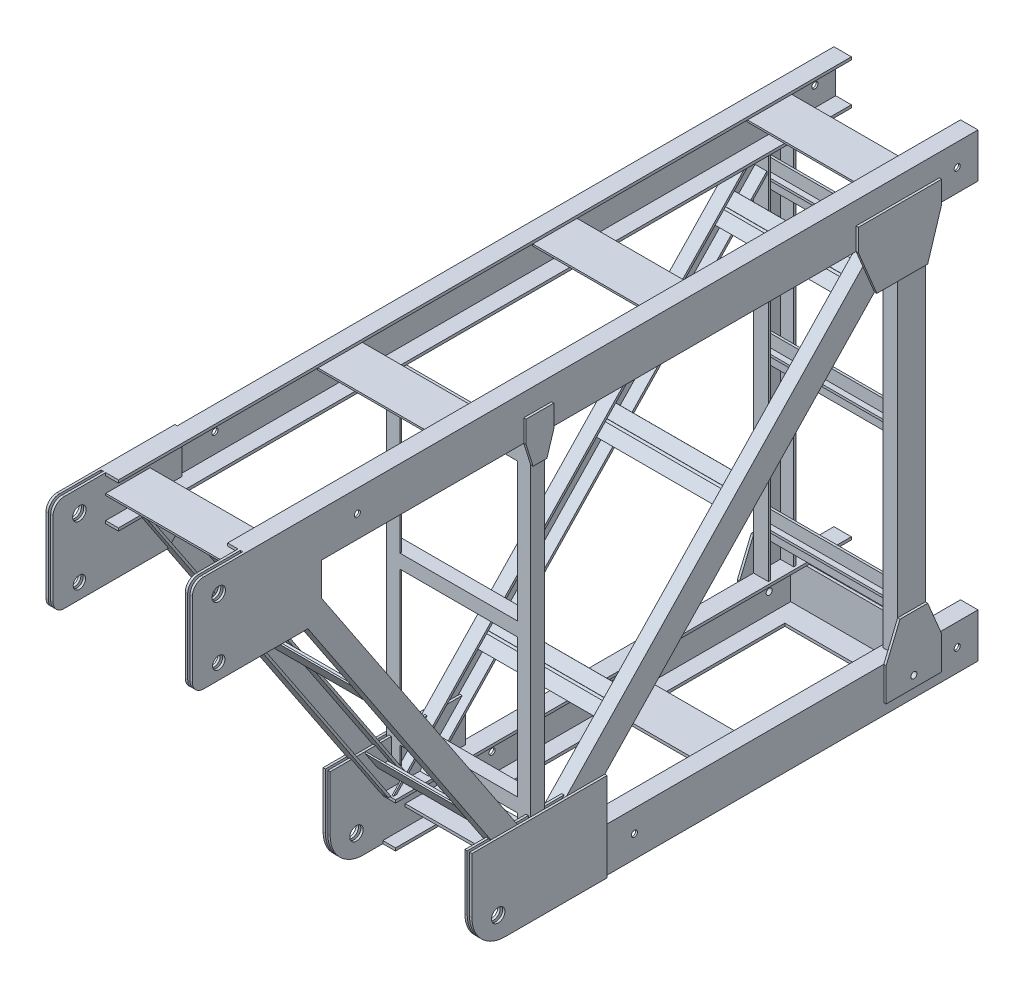
from build123d import *

# Parameters (mm, degrees)
EXTRUDE_1_DEPTH                   = 2835
EXTRUDE_1_2_DEPTH                 = 2835
PATTERN_LINEAR_2_COUNT            = 2
PATTERN_LINEAR_2_PITCH            = 1500
SKETCH_4_W                        = 520
SKETCH_4_H                        = 1000
CUT_EXTRUDE_2_DEPTH               = 1000
EXTRUDE_3_DEPTH                   = 520
SKETCH_8_W                        = 100
SKETCH_8_H                        = 1340
EXTRUDE_7_DEPTH                   = 520
CUT_EXTRUDE_9_DEPTH               = 1340
SKETCH_11_R                       = 11
CUT_EXTRUDE_10_DEPTH              = 3250.249913442
EXTRUDE_11_DEPTH                  = 48
PATTERN_LINEAR_3_COUNT            = 2
PATTERN_LINEAR_3_PITCH            = 472
CUT_EXTRUDE_12_DEPTH              = 42.7
CUT_EXTRUDE_13_DEPTH              = 42.7
EXTRUDE_14_DEPTH                  = 43
PATTERN_LINEAR_4_COUNT            = 2
PATTERN_LINEAR_4_PITCH            = 477
CUT_EXTRUDE_15_DEPTH              = 38
CUT_EXTRUDE_16_DEPTH              = 38
EXTRUDE_17_DEPTH                  = 520
SKETCH_19_W                       = 394
SKETCH_19_H                       = 50
CUT_EXTRUDE_18_DEPTH              = 3250.249913442
CUT_EXTRUDE_19_DEPTH              = 15
CUT_EXTRUDE_20_DEPTH              = 15
CUT_EXTRUDE_21_DEPTH              = 45
CUT_EXTRUDE_22_DEPTH              = 45
PATTERN_LINEAR_6_COUNT            = 4
PATTERN_LINEAR_6_PITCH            = 775
SKETCH_27_W                       = 520
SKETCH_27_H                       = 160
EXTRUDE_24_DEPTH                  = 10
SKETCH_28_W                       = 507
SKETCH_28_H                       = 10
EXTRUDE_25_DEPTH                  = 140
EXTRUDE_26_DEPTH                  = 520
PATTERN_LINEAR_9_COUNT            = 3
PATTERN_LINEAR_9_PITCH            = 550
EXTRUDE_27_DEPTH                  = 520
PATTERN_LINEAR_10_COUNT           = 3
PATTERN_LINEAR_10_PITCH           = 620
EXTRUDE_28_DEPTH                  = 520
SKETCH_32_W                       = 400
SKETCH_32_H                       = 5
EXTRUDE_29_DEPTH                  = 15
PATTERN_LINEAR_11_COUNT           = 3
PATTERN_LINEAR_11_PITCH           = 675
SKETCH_38_W                       = 520
SKETCH_38_H                       = 50
EXTRUDE_36_DEPTH                  = 50
SKETCH_38_2_W                     = 520
SKETCH_38_2_H                     = 50
EXTRUDE_37_DEPTH                  = 50
PATTERN_LINEAR_13_COUNT           = 3
PATTERN_LINEAR_13_PITCH           = 550
SKETCH_39_W                       = 514
SKETCH_39_H                       = 45
CUT_EXTRUDE_38_DEPTH              = 45
SKETCH_40_W                       = 488.125335809
SKETCH_40_H                       = 320
EXTRUDE_39_DEPTH                  = 8.5
PATTERN_LINEAR_15_COUNT           = 2
PATTERN_LINEAR_15_PITCH           = 17
PATTERN_LINEAR_16_COUNT           = 2
PATTERN_LINEAR_16_PITCH           = 511.5
PATTERN_LINEAR_16_COPY_1_SKETCH_W = 488.125335809
PATTERN_LINEAR_16_COPY_1_SKETCH_H = 320
PATTERN_LINEAR_16_COPY_1_DEPTH    = 8.5
SKETCH_41_W                       = 8.5
SKETCH_41_H                       = 160
SKETCH_41_W_2                     = 486
CUT_EXTRUDE_40_DEPTH              = 190
SKETCH_42_W                       = 160
SKETCH_42_H                       = 10
EXTRUDE_41_DEPTH                  = 503
FILLET_1_R                        = 120
SKETCH_43_R                       = 24.25
CUT_EXTRUDE_42_DEPTH              = 3253.013837609
SKETCH_44_W                       = 465
SKETCH_44_H                       = 350
EXTRUDE_43_DEPTH                  = 8.5
PATTERN_LINEAR_17_COUNT           = 2
PATTERN_LINEAR_17_PITCH           = 17
SKETCH_45_W                       = 8.5
SKETCH_45_H                       = 350
SKETCH_45_W_2                     = 496.5
CUT_EXTRUDE_44_DEPTH              = 190
CHAMFER_1_SIZE                    = 50
SKETCH_46_R                       = 24.25
CUT_EXTRUDE_45_DEPTH              = 3253.013837609
EXTRUDE_46_DEPTH                  = 8.5
PATTERN_LINEAR_19_COUNT           = 2
PATTERN_LINEAR_19_PITCH           = 528.5
PATTERN_LINEAR_20_COUNT           = 2
PATTERN_LINEAR_20_PITCH           = 662
PATTERN_LINEAR_21_COUNT           = 2
PATTERN_LINEAR_21_PITCH           = 520
PATTERN_LINEAR_22_COUNT           = 2
PATTERN_LINEAR_22_PITCH           = 503
SKETCH_49_R                       = 24.25
SKETCH_49_R_2                     = 22.25
CUT_EXTRUDE_48_DEPTH              = 3251.621056045
FILLET_2_R                        = 40
SKETCH_51_R                       = 11
CUT_EXTRUDE_50_DEPTH              = 3253.013837609


with BuildPart() as part:
    # 草图2 → 拉伸1 (new body)
    with BuildSketch(Plane.XY):
        Polygon((0, 0), (0, 160), (63, 160), (63, 150), (6.5, 150), (6.5, 10), (63, 10), (63, 0), align=None)
    extrude_1 = extrude(amount=EXTRUDE_1_DEPTH)



with BuildPart() as body_2:
    # 草图2 → Extrude 1 2 (new body)
    with BuildSketch(Plane.XY):
        Polygon((457, 160), (520, 160), (520, 0), (457, 0), (457, 10), (513.5, 10), (513.5, 150), (457, 150), align=None)
    extrude_1_2 = extrude(amount=EXTRUDE_1_2_DEPTH)


with BuildPart() as pattern_linear_2_1:
    # 阵列(线性)2: pattern copy
    add(extrude_1.moved(Location(Vector(0, -1, 0) * (1 * PATTERN_LINEAR_2_PITCH))))


with BuildPart() as pattern_linear_2_2:
    # 阵列(线性)2: pattern copy
    add(extrude_1_2.moved(Location(Vector(0, -1, 0) * (1 * PATTERN_LINEAR_2_PITCH))))


with BuildPart() as cut_extrude_2_tool:
    # 草图4 → 拉伸2 (new body)
    with BuildSketch(Plane(origin=(0, -1340, 0), x_dir=(1, 0, 0), z_dir=(0, 1, 0))):
        with Locations((260, -2335)):
            Rectangle(SKETCH_4_W, SKETCH_4_H)
    extrude(amount=-CUT_EXTRUDE_2_DEPTH)


with BuildPart() as pattern_linear_2_1_1:
    add(pattern_linear_2_1.part)

    # 拉伸2: cut by cut_extrude_2_tool
    add(cut_extrude_2_tool.part, mode=Mode.SUBTRACT)


with BuildPart() as pattern_linear_2_2_1:
    add(pattern_linear_2_2.part)

    # 拉伸2: cut by cut_extrude_2_tool
    add(cut_extrude_2_tool.part, mode=Mode.SUBTRACT)


with BuildPart() as part_1:
    add(part.part)

    add(body_2.part)  # 拉伸3 merges body 2
    # 草图5 → 拉伸3 (add)
    with BuildSketch(Plane.ZY):
        Polygon((160, 95), (320, 95), (320, 88.5), (243.25, 88.5), (243.25, 48.5), (236.75, 48.5), (236.75, 88.5), (160, 88.5), align=None)
    extrude_3 = extrude(amount=-EXTRUDE_3_DEPTH)

    # 草图11 → 拉伸10 (cut, through all)
    with BuildSketch(Plane.ZY):
        with Locations((2740, 80)):
            Circle(SKETCH_11_R)
    extrude(amount=-CUT_EXTRUDE_10_DEPTH, mode=Mode.SUBTRACT)


    add(pattern_linear_2_1_1.part)  # 拉伸11 merges 阵列(线性)2_1


with BuildPart() as body_4:
    # 草图8 → 拉伸7 (new body)
    with BuildSketch(Plane.ZY):
        with Locations((240, -670)):
            Rectangle(SKETCH_8_W, SKETCH_8_H)
    extrude(amount=-EXTRUDE_7_DEPTH)

    # 草图10 → 拉伸9 (cut)
    with BuildSketch(Plane.XZ.offset(1340)):
        Polygon((466.7, 290), (466.7, 281.5), (514.7, 281.5), (514.7, 198.5), (466.7, 198.5), (466.7, 190), (53.3, 190), (53.3, 198.5), (5.3, 198.5), (5.3, 281.5), (53.3, 281.5), (53.3, 290), align=None)
    extrude(amount=-CUT_EXTRUDE_9_DEPTH, mode=Mode.SUBTRACT)


with BuildPart() as cut_extrude_9_piece_1:
    # of the separate pieces the step leaves, piece 1, a body of its own (cut_extrude_9_pieces)
    add(body_4.part.solids().sort_by_distance((0, 0, 190))[0])


with BuildPart() as cut_extrude_9_piece_2:
    # of the separate pieces the step leaves, piece 2, a body of its own (cut_extrude_9_pieces)
    add(body_4.part.solids().sort_by_distance((466.7, 0, 198.5))[0])


with BuildPart() as part_2:
    add(part_1.part)

    add(cut_extrude_9_piece_1.part)  # 拉伸11 merges 拉伸9 piece 1
    # 草图12 → 拉伸11 (add)
    with BuildSketch(Plane.ZY):
        Polygon((290, 0), (359.111251302, 0), (1637.773223133, -1340), (1499.550720529, -1340), (290, -72.42655118), align=None)
    extrude_11 = extrude(amount=-EXTRUDE_11_DEPTH)


    add(pattern_linear_2_2_1.part)  # 阵列(线性)3 merges 阵列(线性)2_2

    add(cut_extrude_9_piece_2.part)  # 阵列(线性)3 merges 拉伸9 piece 2
    # 阵列(线性)3: 拉伸11 ×2
    with Locations(*[(i * PATTERN_LINEAR_3_PITCH, 0, 0) for i in range(1, PATTERN_LINEAR_3_COUNT)]):
        add(extrude_11)

    # 草图13 → 拉伸12 (cut)
    with BuildSketch(Plane(origin=(48, 0, 0), x_dir=(0, 0, -1), z_dir=(1, 0, 0))):
        Polygon((-347.362338581, 0), (-290, 0), (-290, -60.114037479), (-1511.29963325, -1340), (-1626.024310412, -1340), align=None)
    extrude(amount=-CUT_EXTRUDE_12_DEPTH, mode=Mode.SUBTRACT)

    # 草图14 → 拉伸13 (cut)
    with BuildSketch(Plane.ZY.offset(-472)):
        Polygon((290, -84.739064881), (290, 0), (347.362338581, 0), (1626.024310412, -1340), (1487.801807808, -1340), align=None)
    extrude(amount=-CUT_EXTRUDE_13_DEPTH, mode=Mode.SUBTRACT)

    # 草图15 → 拉伸14 (add)
    with BuildSketch(Plane.ZY):
        Polygon((2496.666666667, 0), (2448.59264966, 0), (1589.196969525, -1289.093520204), (1637.773223133, -1340), (1651.40735034, -1340), (2544.740683673, 0), align=None)
    extrude_14 = extrude(amount=-EXTRUDE_14_DEPTH)

    # 阵列(线性)4: 拉伸14 ×2
    with Locations(*[(i * PATTERN_LINEAR_4_PITCH, 0, 0) for i in range(1, PATTERN_LINEAR_4_COUNT)]):
        add(extrude_14)

    # 草图16 → 拉伸15 (cut)
    with BuildSketch(Plane.ZY.offset(-477)):
        Polygon((2458.207453062, 0), (2535.125880272, 0), (1641.792546938, -1340), (1564.874119728, -1340), align=None)
    extrude(amount=-CUT_EXTRUDE_15_DEPTH, mode=Mode.SUBTRACT)

    # 草图17 → 拉伸16 (cut)
    with BuildSketch(Plane(origin=(43, 0, 0), x_dir=(0, 0, -1), z_dir=(1, 0, 0))):
        Polygon((-2535.125880272, 0), (-2458.207453062, 0), (-1564.874119728, -1340), (-1641.792546938, -1340), align=None)
    extrude(amount=-CUT_EXTRUDE_16_DEPTH, mode=Mode.SUBTRACT)

    # 阵列(线性)6: 拉伸3 ×4
    with Locations(*[(0, 0, i * PATTERN_LINEAR_6_PITCH) for i in range(1, PATTERN_LINEAR_6_COUNT)]):
        add(extrude_3)

    # 草图27 → 拉伸24 (add)
    with BuildSketch(Plane.XZ.offset(1500)):
        with Locations((260, 160)):
            Rectangle(SKETCH_27_W, SKETCH_27_H)
    extrude(amount=-EXTRUDE_24_DEPTH)

    # 草图28 → 拉伸25 (add)
    with BuildSketch(Plane(origin=(0, -1490, 0), x_dir=(1, 0, 0), z_dir=(0, 1, 0))):
        with Locations((260, -157.5)):
            Rectangle(SKETCH_28_W, SKETCH_28_H)
    extrude(amount=EXTRUDE_25_DEPTH)

    # 草图29 → 拉伸26 (add)
    with BuildSketch(Plane.ZY):
        Polygon((231.5, -1160), (231.5, -1260), (240, -1260), (240, -1214.25), (260, -1214.25), (260, -1205.75), (240, -1205.75), (240, -1160), align=None)
    extrude_26 = extrude(amount=-EXTRUDE_26_DEPTH)

    # 阵列(线性)9: 拉伸26 ×3
    with Locations(*[(0, i * PATTERN_LINEAR_9_PITCH, 0) for i in range(1, PATTERN_LINEAR_9_COUNT)]):
        add(extrude_26)

    # 草图30 → 拉伸27 (add)
    with BuildSketch(Plane.ZY):
        Polygon((372.01655097, -98.263437964), (441.052007146, -170.61055809), (447.201512357, -164.742544315), (415.617791156, -131.643736857), (430.087215181, -117.836645622), (424.219201406, -111.687140411), (409.749777381, -125.494231647), (378.16605618, -92.395424189), align=None)
    extrude_27 = extrude(amount=-EXTRUDE_27_DEPTH)

    # 阵列(线性)10: 拉伸27 ×3
    with Locations(*[Vector(0, -0.723471201258805, 0.690354561764563) * (i * PATTERN_LINEAR_10_PITCH) for i in range(1, PATTERN_LINEAR_10_COUNT)]):
        add(extrude_27)

    # 草图31 → 拉伸28 (add)
    with BuildSketch(Plane(origin=(520, 0, 0), x_dir=(0, 0, -1), z_dir=(1, 0, 0))):
        Polygon((-2453.908526541, -59.630271094), (-2409.532510843, -126.194294641), (-2413.692762315, -128.967795622), (-2458.068778013, -62.403772075), align=None)
    extrude_28 = extrude(amount=-EXTRUDE_28_DEPTH)

    # 草图32 → 拉伸29 (add)
    with BuildSketch(Plane(origin=(0, -1150.920941817, 1726.381412726), x_dir=(-1, 0, 0), z_dir=(0, 0.5547001962252278, -0.8320502943378446))):
        with Locations((-260, 1271.568156576)):
            Rectangle(SKETCH_32_W, SKETCH_32_H)
    extrude_29 = extrude(amount=EXTRUDE_29_DEPTH)

    # 阵列(线性)11: 拉伸28, 拉伸29 ×3
    with Locations(*[Vector(0, -0.8320502943378436, -0.5547001962252294) * (i * PATTERN_LINEAR_11_PITCH) for i in range(1, PATTERN_LINEAR_11_COUNT)]):
        add(extrude_28)
        add(extrude_29)


with BuildPart() as body_2_2:
    # 草图18 → 拉伸17 (new body)
    with BuildSketch(Plane.ZY):
        Polygon((1564.196969525, 0), (1614.196969525, 0), (1614.196969525, -1251.593520204), (1589.196969525, -1289.093520204), (1564.196969525, -1262.894258211), align=None)
    extrude(amount=-EXTRUDE_17_DEPTH)

    # 草图19 → 拉伸18 (cut, through all)
    with BuildSketch(Plane(origin=(0, 0, 0), x_dir=(1, 0, 0), z_dir=(0, 1, 0))):
        with Locations((260, -1589.196969525)):
            Rectangle(SKETCH_19_W, SKETCH_19_H)
    extrude(amount=-CUT_EXTRUDE_18_DEPTH, mode=Mode.SUBTRACT)


with BuildPart() as cut_extrude_18_piece_1:
    # of the separate pieces the step leaves, piece 1, a body of its own (cut_extrude_18_pieces)
    add(body_2_2.part.solids().sort_by_distance((0, 0, 1564.196969525))[0])

    # 草图21 → 拉伸20 (cut)
    with BuildSketch(Plane(origin=(63, 0, 0), x_dir=(0, 0, -1), z_dir=(1, 0, 0))):
        Polygon((-1614.196969525, -1251.593520204), (-1589.196969525, -1289.093520204), (-1564.196969525, -1262.894258211), (-1564.196969525, 0), (-1614.196969525, 0), align=None)
    extrude(amount=-CUT_EXTRUDE_20_DEPTH, mode=Mode.SUBTRACT)

    # 草图24 → 拉伸22 (cut)
    with BuildSketch(Plane(origin=(48, 0, 0), x_dir=(0, 0, -1), z_dir=(1, 0, 0))):
        Polygon((-1609.196969525, -1259.093520204), (-1589.196969525, -1289.093520204), (-1564.196969525, -1262.894258211), (-1564.196969525, 0), (-1609.196969525, 0), align=None)
    extrude(amount=-CUT_EXTRUDE_22_DEPTH, mode=Mode.SUBTRACT)


with BuildPart() as cut_extrude_18_piece_2:
    # of the separate pieces the step leaves, piece 2, a body of its own (cut_extrude_18_pieces)
    add(body_2_2.part.solids().sort_by_distance((457, 0, 1614.196969525))[0])

    # 草图20 → 拉伸19 (cut)
    with BuildSketch(Plane.ZY.offset(-457)):
        Polygon((1564.196969525, 0), (1614.196969525, 0), (1614.196969525, -1251.593520204), (1589.196969525, -1289.093520204), (1564.196969525, -1262.894258211), align=None)
    extrude(amount=-CUT_EXTRUDE_19_DEPTH, mode=Mode.SUBTRACT)

    # 草图23 → 拉伸21 (cut)
    with BuildSketch(Plane.ZY.offset(-472)):
        Polygon((1609.196969525, -1259.093520204), (1589.196969525, -1289.093520204), (1564.196969525, -1262.894258211), (1564.196969525, 0), (1609.196969525, 0), align=None)
    extrude(amount=-CUT_EXTRUDE_21_DEPTH, mode=Mode.SUBTRACT)


    add(cut_extrude_18_piece_1.part)  # 拉伸36 merges 拉伸18 piece 1

    add(part_2.part)  # 拉伸36 merges part
    # 草图38 → 拉伸36 (add)
    with BuildSketch(Plane.XY.offset(1614.196969525)):
        with Locations((260, -1166.593520204)):
            Rectangle(SKETCH_38_W, SKETCH_38_H)
    extrude(amount=-EXTRUDE_36_DEPTH)

    # 草图38<2> → 拉伸37 (add)
    with BuildSketch(Plane.XY.offset(1614.196969525)):
        with Locations((260, -1166.593520204)):
            Rectangle(SKETCH_38_2_W, SKETCH_38_2_H)
    extrude_37 = extrude(amount=-EXTRUDE_37_DEPTH)

    # 阵列(线性)13: 拉伸37 ×3
    with Locations(*[(0, i * PATTERN_LINEAR_13_PITCH, 0) for i in range(1, PATTERN_LINEAR_13_COUNT)]):
        add(extrude_37)

    # 草图39 → 拉伸38 (cut)
    with BuildSketch(Plane(origin=(0, 0, 1564.196969525), x_dir=(-1, 0, 0), z_dir=(0, 0, -1))):
        with Locations((-260, -1169.093520204)):
            Rectangle(SKETCH_39_W, SKETCH_39_H)
        with Locations((-260, -619.093520204)):
            Rectangle(SKETCH_39_W, SKETCH_39_H)
        with Locations((-260, -69.093520204)):
            Rectangle(SKETCH_39_W, SKETCH_39_H)
    extrude(amount=-CUT_EXTRUDE_38_DEPTH, mode=Mode.SUBTRACT)

    # 草图40 → 拉伸39 (add)
    with BuildSketch(Plane(origin=(520, 0, 0), x_dir=(0, 0, -1), z_dir=(1, 0, 0))):
        with Locations((-1590.937332096, -1340)):
            Rectangle(SKETCH_40_W, SKETCH_40_H)
    extrude_39 = extrude(amount=EXTRUDE_39_DEPTH)

    # 阵列(线性)15: 拉伸39 ×2
    with Locations(*[(-i * PATTERN_LINEAR_15_PITCH, 0, 0) for i in range(1, PATTERN_LINEAR_15_COUNT)]):
        add(extrude_39)

    # 阵列(线性)16: 拉伸39 ×2
    with Locations(*[(-i * PATTERN_LINEAR_16_PITCH, 0, 0) for i in range(1, PATTERN_LINEAR_16_COUNT)]):
        add(extrude_39)

    # 阵列(线性)16 copy 1 sketch → 阵列(线性)16 copy 1 (add)
    with BuildSketch(Plane(origin=(-8.5, 0, 0), x_dir=(0, 0, -1), z_dir=(1, 0, 0))):
        with Locations((-1590.937332096, -1340)):
            Rectangle(PATTERN_LINEAR_16_COPY_1_SKETCH_W, PATTERN_LINEAR_16_COPY_1_SKETCH_H)
    extrude(amount=PATTERN_LINEAR_16_COPY_1_DEPTH)

    # 草图41 → 拉伸40 (cut)
    with BuildSketch(Plane.XY.offset(1835)):
        with Locations((4.25, -1420)):
            Rectangle(SKETCH_41_W, SKETCH_41_H)
        with Locations((260, -1420)):
            Rectangle(SKETCH_41_W_2, SKETCH_41_H)
        with Locations((515.75, -1420)):
            Rectangle(SKETCH_41_W, SKETCH_41_H)
    extrude(amount=-CUT_EXTRUDE_40_DEPTH, mode=Mode.SUBTRACT)

    # 草图42 → 拉伸41 (add)
    with BuildSketch(Plane.ZY.offset(-503)):
        with Locations((1484.196969525, -1420)):
            Rectangle(SKETCH_42_W, SKETCH_42_H)
    extrude_41 = extrude(amount=EXTRUDE_41_DEPTH)

    # 圆角1
    fillet_1_edges = [cut_extrude_18_piece_2.edges().sort_by_distance(p)[0] for p in [
        (524.25, -1500, 1835),
        (-4.25, -1500, 1835),
        (12.75, -1500, 1835),
        (507.25, -1500, 1835),
    ]]
    fillet(fillet_1_edges, radius=FILLET_1_R)

    # 草图43 → 拉伸42 (cut, through all)
    with BuildSketch(Plane.ZY.offset(8.5)):
        with Locations((1740, -1420)):
            Circle(SKETCH_43_R)
    extrude(amount=-CUT_EXTRUDE_42_DEPTH, mode=Mode.SUBTRACT)

    # 草图44 → 拉伸43 (add)
    with BuildSketch(Plane.ZY):
        with Locations((2602.5, -15)):
            Rectangle(SKETCH_44_W, SKETCH_44_H)
    extrude_43 = extrude(amount=EXTRUDE_43_DEPTH)

    # 阵列(线性)17: 拉伸43 ×2
    with Locations(*[(i * PATTERN_LINEAR_17_PITCH, 0, 0) for i in range(1, PATTERN_LINEAR_17_COUNT)]):
        add(extrude_43)

    # 草图45 → 拉伸44 (cut)
    with BuildSketch(Plane.XY.offset(2835)):
        with Locations((4.25, -15)):
            Rectangle(SKETCH_45_W, SKETCH_45_H)
        with Locations((265.25, -15)):
            Rectangle(SKETCH_45_W_2, SKETCH_45_H)
    extrude(amount=-CUT_EXTRUDE_44_DEPTH, mode=Mode.SUBTRACT)

    # 倒角1
    # the kernel refuses this chamfer: 50 mm, written as the material it takes off along each edge
    with BuildSketch(Plane(origin=(128.584149398, -190, 2370), x_dir=(0, 0.9996219169112969, -0.0274958766105822), z_dir=(-1, 0, 0))) as chamfer_1_piece_1_section:
        Polygon((CHAMFER_1_SIZE * 0.999621916911, -CHAMFER_1_SIZE * 0.0274958766106), (-CHAMFER_1_SIZE * 0.0274958766106, -CHAMFER_1_SIZE * 0.999621916911), (0, 0), align=None)
    chamfer_1_piece_1 = extrude(amount=265.668298797, mode=Mode.PRIVATE)
    chamfer_1_piece_1 = split(chamfer_1_piece_1, bisect_by=Plane(origin=(5, -172.859199894, 2385.769211679), z_dir=(1, 0, 0)), keep=Keep.TOP, mode=Mode.PRIVATE)
    chamfer_1_piece_1 = split(chamfer_1_piece_1, bisect_by=Plane(origin=(12.75, -188.605600815, 2409.388813062), z_dir=(0, 0.5547001962252294, -0.8320502943378436)), keep=Keep.TOP, mode=Mode.PRIVATE)
    add(chamfer_1_piece_1, mode=Mode.SUBTRACT)
    with BuildSketch(Plane(origin=(0, -190, 2370), x_dir=(0, 0.9996219169112969, -0.027495876610582184), z_dir=(-1, 0, 0))) as chamfer_1_piece_2:
        Polygon((CHAMFER_1_SIZE * 0.999621916911, -CHAMFER_1_SIZE * 0.0274958766106), (-CHAMFER_1_SIZE * 0.0274958766106, -CHAMFER_1_SIZE * 0.999621916911), (0, 0), align=None)
    extrude(amount=137.084149398, mode=Mode.SUBTRACT)
    with BuildSketch(Plane(origin=(145.584149398, -190, 2370), x_dir=(0, 0.9996219169112969, -0.0274958766105822), z_dir=(-1, 0, 0))) as chamfer_1_piece_3_section:
        Polygon((CHAMFER_1_SIZE * 0.999621916911, -CHAMFER_1_SIZE * 0.0274958766106), (-CHAMFER_1_SIZE * 0.0274958766106, -CHAMFER_1_SIZE * 0.999621916911), (0, 0), align=None)
    chamfer_1_piece_3 = extrude(amount=265.668298797, mode=Mode.PRIVATE)
    chamfer_1_piece_3 = split(chamfer_1_piece_3, bisect_by=Plane(origin=(5, -172.859199894, 2385.769211679), z_dir=(1, 0, 0)), keep=Keep.TOP, mode=Mode.PRIVATE)
    chamfer_1_piece_3 = split(chamfer_1_piece_3, bisect_by=Plane(origin=(12.75, -188.605600815, 2409.388813062), z_dir=(0, 0.5547001962252294, -0.8320502943378436)), keep=Keep.TOP, mode=Mode.PRIVATE)
    add(chamfer_1_piece_3, mode=Mode.SUBTRACT)
    with BuildSketch(Plane(origin=(145.584149398, -190, 2370), x_dir=(0, 0.9996219169112969, -0.0274958766105822), z_dir=(-1, 0, 0))) as chamfer_1_piece_4_section:
        Polygon((CHAMFER_1_SIZE * 0.999621916911, -CHAMFER_1_SIZE * 0.0274958766106), (-CHAMFER_1_SIZE * 0.0274958766106, -CHAMFER_1_SIZE * 0.999621916911), (0, 0), align=None)
    chamfer_1_piece_4 = extrude(amount=265.668298797, mode=Mode.PRIVATE)
    chamfer_1_piece_4 = split(chamfer_1_piece_4, bisect_by=Plane(origin=(0, -172.859199894, 2385.769211679), z_dir=(-1, 0, 0)), keep=Keep.TOP, mode=Mode.PRIVATE)
    add(chamfer_1_piece_4, mode=Mode.SUBTRACT)

    # 草图46 → 拉伸45 (cut, through all)
    with BuildSketch(Plane.ZY.offset(8.5)):
        with Locations(Location((2740, 80, 0), (0, 0, 90))):
            Circle(SKETCH_46_R)
    extrude(amount=-CUT_EXTRUDE_45_DEPTH, mode=Mode.SUBTRACT)

    # 草图47 → 拉伸46 (add)
    with BuildSketch(Plane.ZY):
        Polygon((140, 80), (140, 0), (190, -160), (373.564805036, -160), (440, 0), (440, 80), align=None)
        Polygon((140, -1460), (340, -1460), (340, -1340), (290, -1220), (190, -1220), (140, -1340), align=None)
        Polygon((1539.196969525, 80), (1639.196969525, 80), (1639.196969525, 0), (1614.196969525, -80), (1564.196969525, -80), (1539.196969525, 0), align=None)
    extrude_46 = extrude(amount=EXTRUDE_46_DEPTH)

    # 阵列(线性)19: 拉伸46 ×2
    with Locations(*[(i * PATTERN_LINEAR_19_PITCH, 0, 0) for i in range(1, PATTERN_LINEAR_19_COUNT)]):
        add(extrude_46)

    # 阵列(线性)20: 拉伸41 ×2
    with Locations(*[(0, 0, -i * PATTERN_LINEAR_20_PITCH) for i in range(1, PATTERN_LINEAR_20_COUNT)]):
        add(extrude_41)

    # 阵列(线性)21: 拉伸43 ×2
    with Locations(*[(i * PATTERN_LINEAR_21_PITCH, 0, 0) for i in range(1, PATTERN_LINEAR_21_COUNT)]):
        add(extrude_43)

    # 阵列(线性)22: 拉伸43 ×2
    with Locations(*[(i * PATTERN_LINEAR_22_PITCH, 0, 0) for i in range(1, PATTERN_LINEAR_22_COUNT)]):
        add(extrude_43)

    # 草图49 → 拉伸48 (cut, through all)
    with BuildSketch(Plane(origin=(520, 0, 0), x_dir=(0, 0, -1), z_dir=(1, 0, 0))):
        with Locations(Location((-2740, 80, 0), (0, 0, 90))):
            Circle(SKETCH_49_R)
        with Locations(Location((-2740, -135, 0), (0, 0, 90))):
            Circle(SKETCH_49_R_2)
    extrude(amount=-CUT_EXTRUDE_48_DEPTH, mode=Mode.SUBTRACT)

    # 圆角2
    fillet_2_edges = [cut_extrude_18_piece_2.edges().sort_by_distance(p)[0] for p in [
        (-4.25, -190, 2835),
        (12.75, -190, 2835),
        (-4.25, 160, 2835),
        (12.75, 160, 2835),
        (515.75, 160, 2835),
        (515.75, -190, 2835),
        (498.75, 160, 2835),
        (498.75, -190, 2835),
    ]]
    fillet(fillet_2_edges, radius=FILLET_2_R)

    # 草图51 → 拉伸50 (cut, through all)
    with BuildSketch(Plane.ZY.offset(8.5)):
        with Locations(Location((2240, 80, 0), (0, 0, 270))):
            Circle(SKETCH_51_R)
        with Locations((1240, -1420)):
            Circle(SKETCH_51_R)
        with Locations(Location((240, -1420, 0), (0, 0, 270))):
            Circle(SKETCH_51_R)
        with Locations(Location((75, 80, 0), (0, 0, 270))):
            Circle(SKETCH_51_R)
        with Locations(Location((75, -1420, 0), (0, 0, 270))):
            Circle(SKETCH_51_R)
    extrude(amount=-CUT_EXTRUDE_50_DEPTH, mode=Mode.SUBTRACT)


solid = cut_extrude_18_piece_2.part
